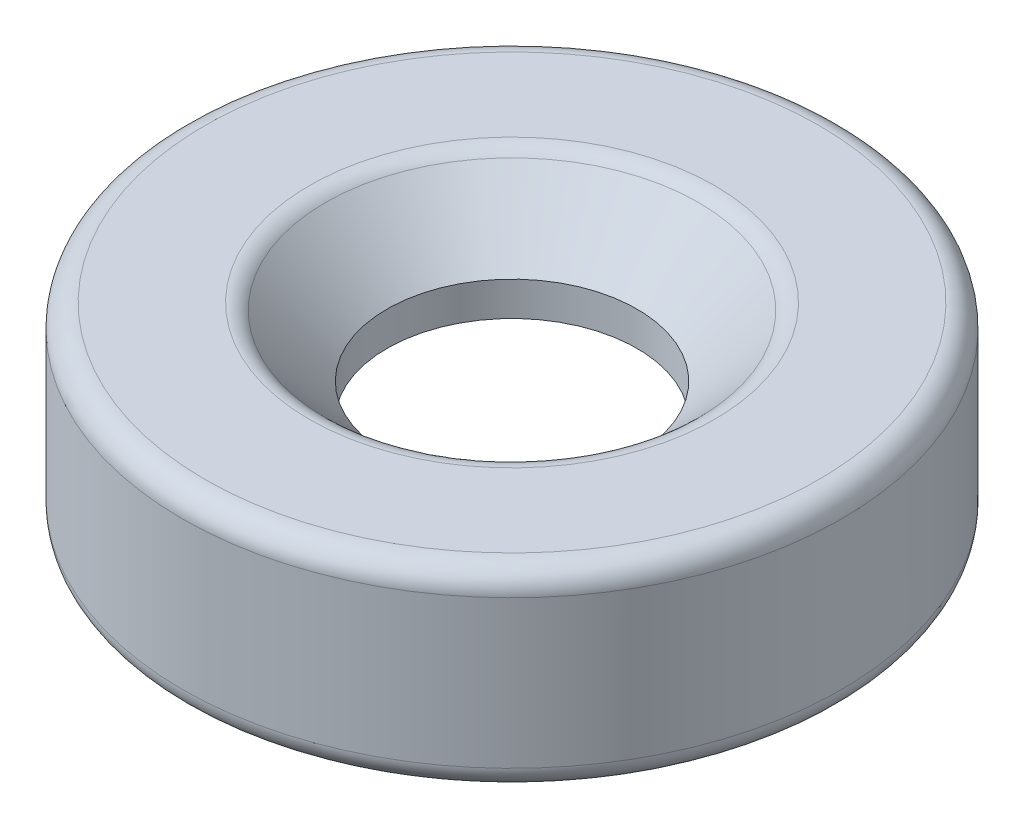
from build123d import *

# Parameters (mm, degrees)
FILLET1_R = 1


# Read off the part's stored shape, not the designer's step: Dog Bowl Washer
with BuildPart() as part:
    # Dog Bowl Washer outline → Dog Bowl Washer (revolve)
    with BuildSketch(Plane.XY):
        with BuildLine():
            Line((5.2705, 1.27), (6.392427617, 0))
            Line((6.392427617, 0), (12.7, 0))
            Line((12.7, 0), (12.646813167, 1.52307162))
            ThreePointArc((12.646813167, 1.52307162), (11.484828724, 4.047470654), (8.87095, 4.9911))
            Line((8.87095, 4.9911), (5.2705, 1.27))
        make_face()
    revolve(axis=Axis((0, 0, 0), (0, 1, 0)))


with BuildPart() as body_2:
    # Sketch1 → Revolve1 (revolve)
    with BuildSketch(Plane.XY, mode=Mode.PRIVATE) as revolve1_sk:
        Polygon((-14.5, 8.5), (-8.5, 8.5), (-5.5, 5.5), (-5.5, 4), (-8.5, 4), (-8.5, 0), (-14.5, 0), align=None)
    revolve(revolve1_sk.sketch.rotate(Axis((0, 10.834647468, 0), (0, -1, 0)), 270), axis=Axis((0, 10.834647468, 0), (0, -1, 0)))

    # Combine1: cut part
    add(part.part, mode=Mode.SUBTRACT)

    # Fillet1
    fillet1_edges = [body_2.edges().sort_by_distance(p)[0] for p in [
        (0, 0, -14.5),
        (0, 8.5, -8.5),
        (0, 8.5, -14.5),
    ]]
    fillet(fillet1_edges, radius=FILLET1_R)


solid = body_2.part
